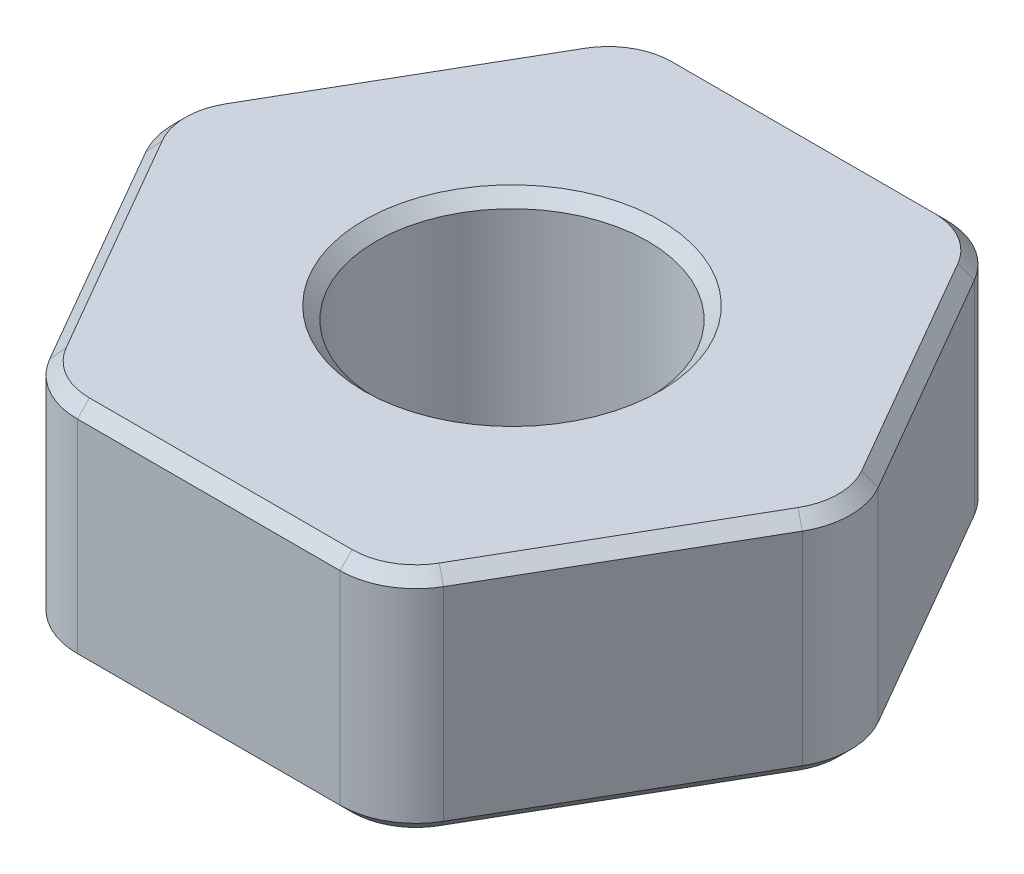
from build123d import *

# Parameters (mm, degrees)
SKETCH3_R           = 1.4224
BOSS_EXTRUDE1_DEPTH = 1.190625
FILLET1_R           = 0.79375
CHAMFER1_SIZE       = 0.127


with BuildPart() as part:
    # Sketch3 → Boss-Extrude1 (new, symmetric)
    with BuildSketch(Plane(origin=(0, 0, 0), x_dir=(1, 0, 0), z_dir=(0, 1, 0))):
        Polygon((1.833087105, 3.175), (-1.833087105, 3.175), (-3.666174209, 0), (-1.833087105, -3.175), (1.833087105, -3.175), (3.666174209, 0), align=None)
        Circle(SKETCH3_R, mode=Mode.SUBTRACT)
    extrude(amount=BOSS_EXTRUDE1_DEPTH, both=True)

    # Fillet1
    fillet1_edges = [part.edges().sort_by_distance(p)[0] for p in [
        (3.666174209, 0, 0),
        (1.833087105, 0, 3.175),
        (-3.666174209, 0, 0),
        (-1.833087105, 0, -3.175),
        (1.833087105, 0, -3.175),
        (-1.833087105, 0, 3.175),
    ]]
    fillet(fillet1_edges, radius=FILLET1_R)

    # Chamfer1
    chamfer1_edges = [part.edges().sort_by_distance(p)[0] for p in [
        (-1.4224, -1.190625, 0),
        (-1.4224, 1.190625, 0),
        (0, 1.190625, -3.175),
        (-1.771690329, 1.190625, -3.068657664),
        (1.771690329, 1.190625, -3.068657664),
        (-2.749630657, 1.190625, -1.5875),
        (2.749630657, 1.190625, -1.5875),
        (-3.543380657, 1.190625, 0),
        (3.543380657, 1.190625, 0),
        (-2.749630657, 1.190625, 1.5875),
        (2.749630657, 1.190625, 1.5875),
        (-1.771690329, 1.190625, 3.068657664),
        (1.771690329, 1.190625, 3.068657664),
        (0, 1.190625, 3.175),
        (0, -1.190625, -3.175),
        (-1.771690329, -1.190625, -3.068657664),
        (1.771690329, -1.190625, -3.068657664),
        (-2.749630657, -1.190625, -1.5875),
        (2.749630657, -1.190625, -1.5875),
        (-3.543380657, -1.190625, 0),
        (3.543380657, -1.190625, 0),
        (-2.749630657, -1.190625, 1.5875),
        (2.749630657, -1.190625, 1.5875),
        (-1.771690329, -1.190625, 3.068657664),
        (1.771690329, -1.190625, 3.068657664),
        (0, -1.190625, 3.175),
    ]]
    chamfer(chamfer1_edges, length=CHAMFER1_SIZE)


solid = part.part
